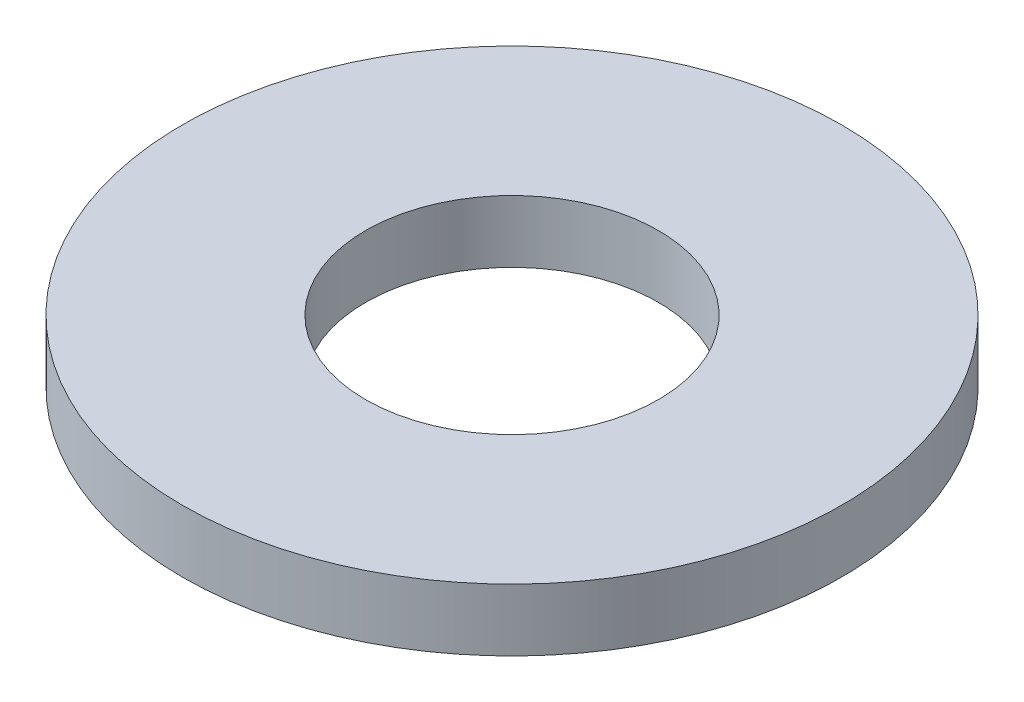
from build123d import *

# Parameters (mm, degrees)
SKETCH1_R           = 90
BOSS_EXTRUDE1_DEPTH = 17
SKETCH2_R           = 40
CUT_EXTRUDE1_DEPTH  = 129.409501206


with BuildPart() as part:
    # Sketch1 → Boss-Extrude1 (new body)
    with BuildSketch(Plane(origin=(0, 0, 0), x_dir=(1, 0, 0), z_dir=(0, 1, 0))):
        Circle(SKETCH1_R)
    extrude(amount=BOSS_EXTRUDE1_DEPTH)

    # Sketch2 → Cut-Extrude1 (cut, through all)
    with BuildSketch(Plane(origin=(0, 0, 0), x_dir=(1, 0, 0), z_dir=(0, 1, 0))):
        Circle(SKETCH2_R)
    extrude(amount=CUT_EXTRUDE1_DEPTH, mode=Mode.SUBTRACT)


solid = part.part
